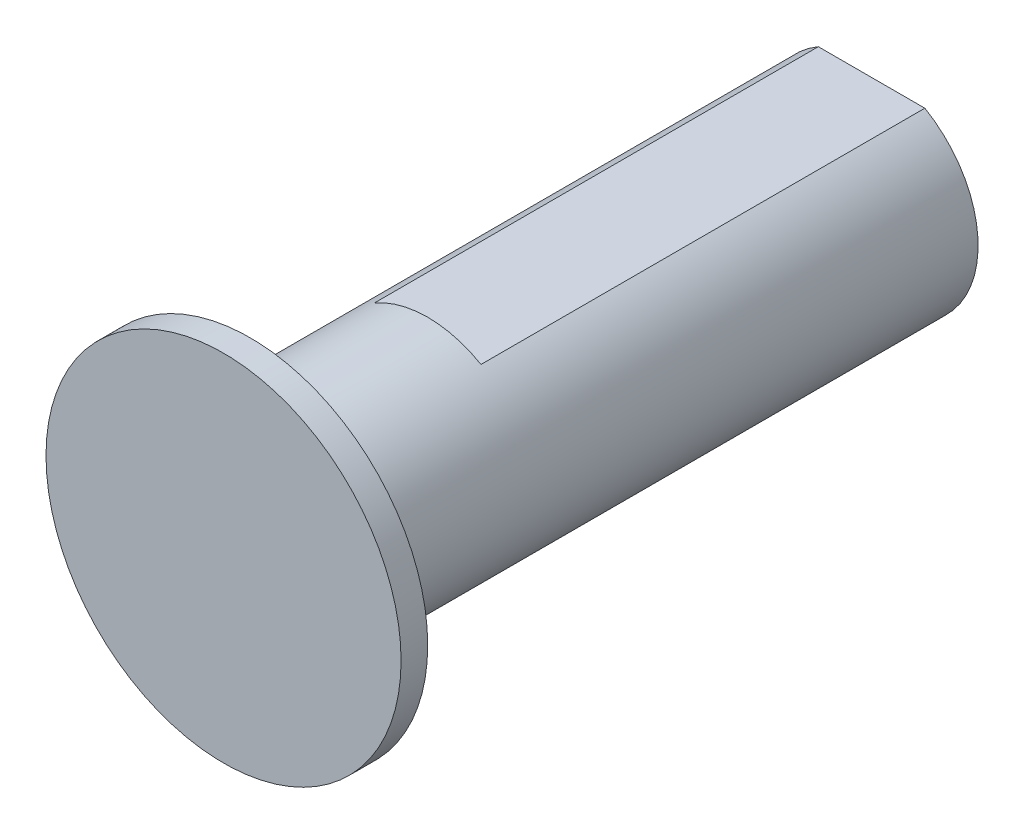
from build123d import *

# Parameters (mm, degrees)
SKETCH1_R           = 6
BOSS_EXTRUDE1_DEPTH = 35
CUT_EXTRUDE1_DEPTH  = 25
SKETCH3_R           = 10
BOSS_EXTRUDE2_DEPTH = 1.5


with BuildPart() as part:
    # Sketch1 → Boss-Extrude1 (new body)
    with BuildSketch(Plane.XY):
        Circle(SKETCH1_R)
    extrude(amount=BOSS_EXTRUDE1_DEPTH)

    # Sketch2 → Cut-Extrude1 (cut)
    with BuildSketch(Plane(origin=(0, 0, 0), x_dir=(-1, 0, 0), z_dir=(0, 0, -1))):
        with BuildLine():
            ThreePointArc((3, 5.196152423), (0, 6), (-3, 5.196152423))
            Line((-3, 5.196152423), (3, 5.196152423))
        make_face()
    extrude(amount=-CUT_EXTRUDE1_DEPTH, mode=Mode.SUBTRACT)

    # Sketch3 → Boss-Extrude2 (add)
    with BuildSketch(Plane.XY.offset(35)):
        Circle(SKETCH3_R)
    extrude(amount=BOSS_EXTRUDE2_DEPTH)


solid = part.part
